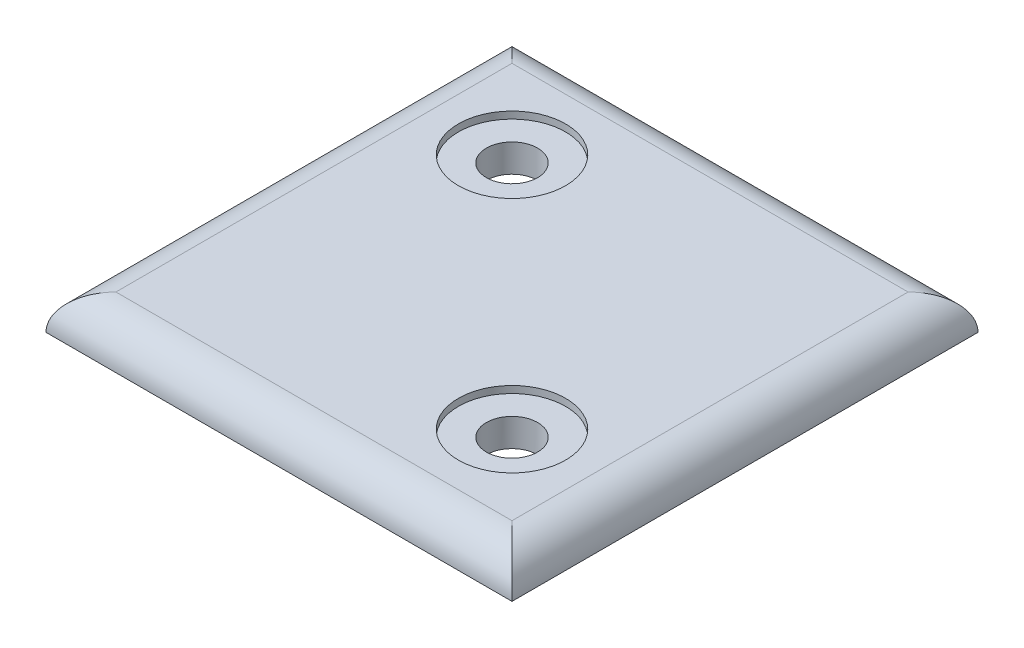
from build123d import *

# Parameters (mm, degrees)
SKETCH1_W           = 40
SKETCH1_H           = 40
BOSS_EXTRUDE1_DEPTH = 3
SKETCH2_R           = 2.2
CUT_EXTRUDE1_DEPTH  = 29.442925307
SKETCH3_R           = 4.6
CUT_EXTRUDE2_DEPTH  = 0.6
FILLET1_R           = 3


with BuildPart() as part:
    # Sketch1 → Boss-Extrude1 (new body)
    with BuildSketch(Plane(origin=(0, 0, 0), x_dir=(1, 0, 0), z_dir=(0, 1, 0))):
        Rectangle(SKETCH1_W, SKETCH1_H)
    extrude(amount=BOSS_EXTRUDE1_DEPTH)

    # Sketch2 → Cut-Extrude1 (cut, through all)
    with BuildSketch(Plane(origin=(0, 3, 0), x_dir=(1, 0, 0), z_dir=(0, 1, 0))):
        with Locations(Location((-10.2, 10.2, 0), (0, 0, 270))):
            Circle(SKETCH2_R)
        with Locations(Location((10.2, -10.2, 0), (0, 0, 90))):
            Circle(SKETCH2_R)
    extrude(amount=-CUT_EXTRUDE1_DEPTH, mode=Mode.SUBTRACT)

    # Sketch3 → Cut-Extrude2 (cut)
    with BuildSketch(Plane(origin=(0, 3, 0), x_dir=(1, 0, 0), z_dir=(0, 1, 0))):
        with Locations(Location((-10.2, 10.2, 0), (0, 0, 270))):
            Circle(SKETCH3_R)
        with Locations(Location((10.2, -10.2, 0), (0, 0, 270))):
            Circle(SKETCH3_R)
    extrude(amount=-CUT_EXTRUDE2_DEPTH, mode=Mode.SUBTRACT)

    # Fillet1
    fillet1_edges = [part.edges().sort_by_distance(p)[0] for p in [
        (20, 3, 0),
        (-20, 3, 0),
        (0, 3, 20),
        (0, 3, -20),
    ]]
    fillet(fillet1_edges, radius=FILLET1_R - 0.0001)  # a hair under: the kernel refuses the full size


solid = part.part
